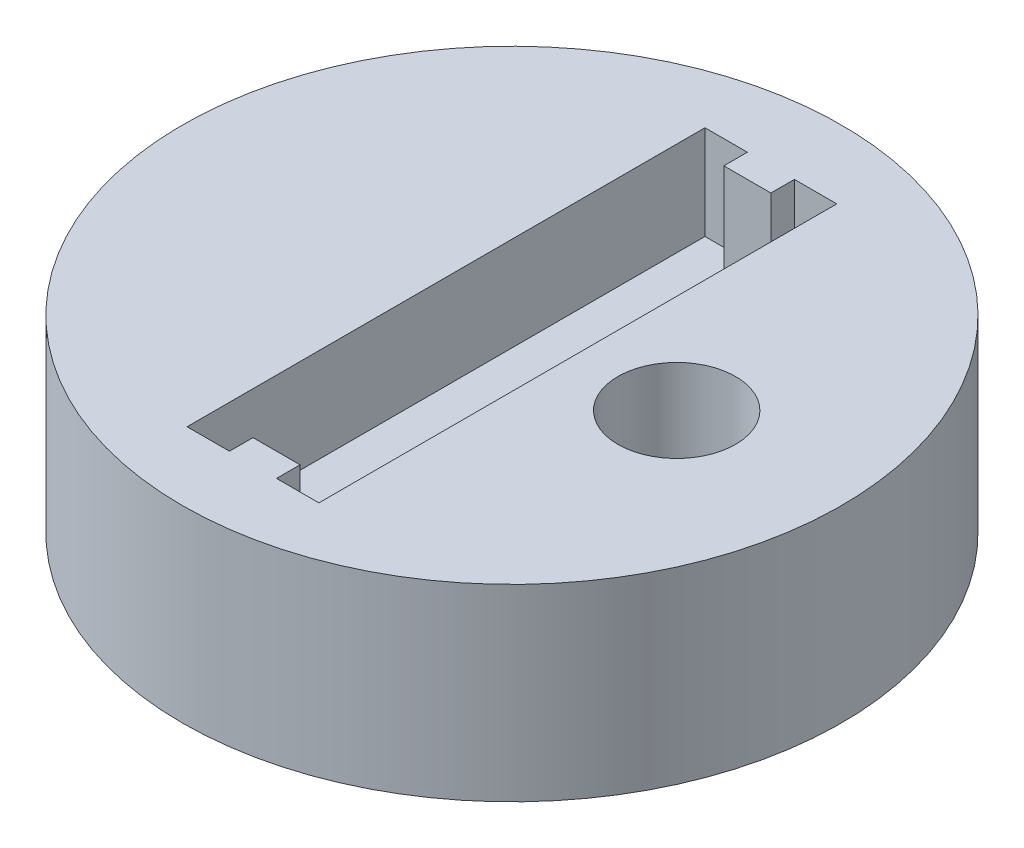
from build123d import *

# Parameters (mm, degrees)
SKETCH1_R           = 7
BOSS_EXTRUDE1_DEPTH = 4
SKETCH2_W           = 0.9
SKETCH2_H           = 11
CUT_EXTRUDE2_DEPTH  = 2
SKETCH3_W           = 1
SKETCH3_H           = 10
CUT_EXTRUDE3_DEPTH  = 2
CUT_EXTRUDE5_DEPTH  = 2


with BuildPart() as part:
    # Sketch1 → Boss-Extrude1 (new body)
    with BuildSketch(Plane(origin=(0, 0, 0), x_dir=(1, 0, 0), z_dir=(0, 1, 0))):
        Circle(SKETCH1_R)
    extrude(amount=BOSS_EXTRUDE1_DEPTH)

    # Sketch2 → Cut-Extrude2 (cut)
    with BuildSketch(Plane(origin=(0, 4, 0), x_dir=(1, 0, 0), z_dir=(0, 1, 0))):
        with Locations((0.95, 0)):
            Rectangle(SKETCH2_W, SKETCH2_H)
    cut_extrude2 = extrude(amount=-CUT_EXTRUDE2_DEPTH, mode=Mode.SUBTRACT)

    # Sketch3 → Cut-Extrude3 (cut)
    with BuildSketch(Plane(origin=(0, 4, 0), x_dir=(1, 0, 0), z_dir=(0, 1, 0))):
        Rectangle(SKETCH3_W, SKETCH3_H)
    extrude(amount=-CUT_EXTRUDE3_DEPTH, mode=Mode.SUBTRACT)

    # Mirror1: Cut-Extrude2 across plane
    add(cut_extrude2.mirror(Plane(origin=(0, 0, 0), x_dir=(0, 0, 1), z_dir=(1, 0, 0))), mode=Mode.SUBTRACT)

    # Sketch7 → Cut-Extrude5 (cut)
    with BuildSketch(Plane(origin=(0, 4, 0), x_dir=(1, 0, 0), z_dir=(0, 1, 0))):
        with BuildLine():
            ThreePointArc((2.25, 0), (3.5, -1.25), (4.75, 0))
            ThreePointArc((4.75, 0), (3.5, 1.25), (2.25, 0))
        make_face()
    extrude(amount=-CUT_EXTRUDE5_DEPTH, mode=Mode.SUBTRACT)


solid = part.part
